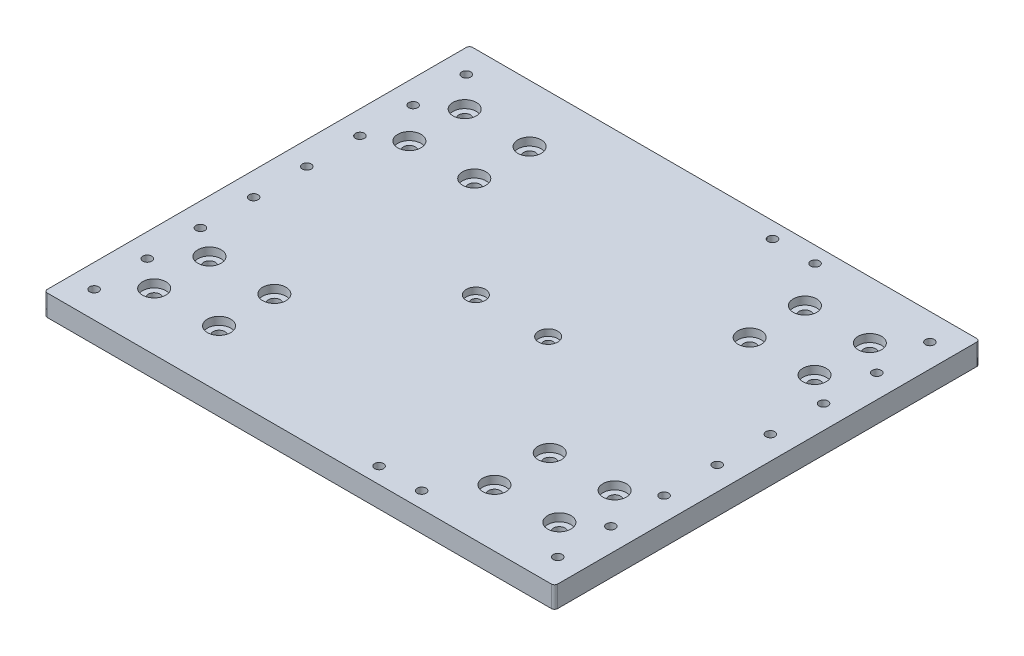
from build123d import *

# Parameters (mm, degrees)
SKETCH1_W                                        = 240
SKETCH1_H                                        = 200
BOSS_EXTRUDE1_DEPTH                              = 5
CBORE_FOR_M5_PAN_HEAD_MACHINE_SCREW1_D           = 5.5
CBORE_FOR_M5_PAN_HEAD_MACHINE_SCREW1_CBORE_D     = 11
CBORE_FOR_M5_PAN_HEAD_MACHINE_SCREW1_CBORE_DEPTH = 3.7
MIRROR2_COPY_1_D                                 = 5.5
MIRROR2_COPY_1_CBORE_D                           = 11
MIRROR2_COPY_1_CBORE_DEPTH                       = 3.7
MIRROR2_COPY_2_D                                 = 5.5
MIRROR2_COPY_2_CBORE_D                           = 11
MIRROR2_COPY_2_CBORE_DEPTH                       = 3.7
CBORE_FOR_M4_PAN_HEAD_MACHINE_SCREW1_D           = 4.5
CBORE_FOR_M4_PAN_HEAD_MACHINE_SCREW1_CBORE_D     = 9
CBORE_FOR_M4_PAN_HEAD_MACHINE_SCREW1_CBORE_DEPTH = 3.1
M5X0_8_TAPPED_HOLE1_D                            = 4.2
FILLET1_R                                        = 1.5
LPATTERN2_COUNT                                  = 8
LPATTERN2_PITCH                                  = 25
M5X0_8_TAPPED_HOLE2_D                            = 4.2


with BuildPart() as part:
    # Sketch1 → Boss-Extrude1 (new, symmetric)
    with BuildSketch(Plane(origin=(0, 0, 0), x_dir=(1, 0, 0), z_dir=(0, 1, 0))):
        Rectangle(SKETCH1_W, SKETCH1_H)
    extrude(amount=BOSS_EXTRUDE1_DEPTH, both=True)

    # CBORE for M5 Pan Head Machine Screw1 (through all)
    with Locations(Plane(origin=(66.92305649, 5, -81.969265096), x_dir=(-1, 0, 0), z_dir=(0, 1, 0))):
        with Locations((162.17305649, 154.969265096), (131.67305649, 154.969265096), (131.67305649, 128.969265096), (162.17305649, 128.969265096)):
            cbore_for_m5_pan_head_machine_screw1 = CounterBoreHole(CBORE_FOR_M5_PAN_HEAD_MACHINE_SCREW1_D / 2, CBORE_FOR_M5_PAN_HEAD_MACHINE_SCREW1_CBORE_D / 2, CBORE_FOR_M5_PAN_HEAD_MACHINE_SCREW1_CBORE_DEPTH)

    # Mirror1: CBORE for M5 Pan Head Machine Screw1 across plane
    add(cbore_for_m5_pan_head_machine_screw1.mirror(Plane(origin=(0, 0, 0), x_dir=(0, 0, 1), z_dir=(1, 0, 0))), mode=Mode.SUBTRACT)

    # Mirror2 copy 1 (through all)
    with Locations(Plane(origin=(-66.92305649, 5, 81.969265096), x_dir=(1, 0, 0), z_dir=(0, 1, 0))):
        with Locations((162.17305649, 154.969265096), (131.67305649, 154.969265096), (131.67305649, 128.969265096), (162.17305649, 128.969265096)):
            CounterBoreHole(MIRROR2_COPY_1_D / 2, MIRROR2_COPY_1_CBORE_D / 2, MIRROR2_COPY_1_CBORE_DEPTH)

    # Mirror2 copy 2 (through all)
    with Locations(Plane(origin=(66.92305649, 5, 81.969265096), x_dir=(-1, 0, 0), z_dir=(0, 1, 0))):
        with Locations((162.17305649, -154.969265096), (131.67305649, -154.969265096), (131.67305649, -128.969265096), (162.17305649, -128.969265096)):
            CounterBoreHole(MIRROR2_COPY_2_D / 2, MIRROR2_COPY_2_CBORE_D / 2, MIRROR2_COPY_2_CBORE_DEPTH)

    # CBORE for M4 Pan Head Machine Screw1 (through all)
    with Locations(Plane(origin=(-30.338508942, 5, -23.538498317), x_dir=(-1, 0, 0), z_dir=(0, 1, 0))):
        with Locations((-13.338508942, 23.538498317), (-47.338508942, 23.538498317)):
            CounterBoreHole(CBORE_FOR_M4_PAN_HEAD_MACHINE_SCREW1_D / 2, CBORE_FOR_M4_PAN_HEAD_MACHINE_SCREW1_CBORE_D / 2, CBORE_FOR_M4_PAN_HEAD_MACHINE_SCREW1_CBORE_DEPTH)

    # M5x0.8 Tapped Hole1 (through all)
    with Locations(Plane(origin=(0, 5, 0), x_dir=(1, 0, 0), z_dir=(0, 1, 0))):
        with Locations((-109, 87.5), (109, 87.5)):
            m5x0_8_tapped_hole1 = Hole(M5X0_8_TAPPED_HOLE1_D / 2)

    # Fillet1
    fillet1_edges = [part.edges().sort_by_distance(p)[0] for p in [
        (-120, 0, -100),
        (120, 0, -100),
        (-120, 0, 100),
        (120, 0, 100),
    ]]
    fillet(fillet1_edges, radius=FILLET1_R)

    # LPattern2: M5x0.8 Tapped Hole1 ×8
    with Locations(*[(0, 0, i * LPATTERN2_PITCH) for i in range(1, LPATTERN2_COUNT)]):
        add(m5x0_8_tapped_hole1, mode=Mode.SUBTRACT)

    # M5x0.8 Tapped Hole2 (through all)
    with Locations(Plane(origin=(0, 5, 0), x_dir=(1, 0, 0), z_dir=(0, 1, 0))):
        with Locations((30, 92.5), (50, 92.5)):
            m5x0_8_tapped_hole2 = Hole(M5X0_8_TAPPED_HOLE2_D / 2)

    # Mirror3: M5x0.8 Tapped Hole2 across plane
    add(m5x0_8_tapped_hole2.mirror(Plane.XY), mode=Mode.SUBTRACT)


solid = part.part
